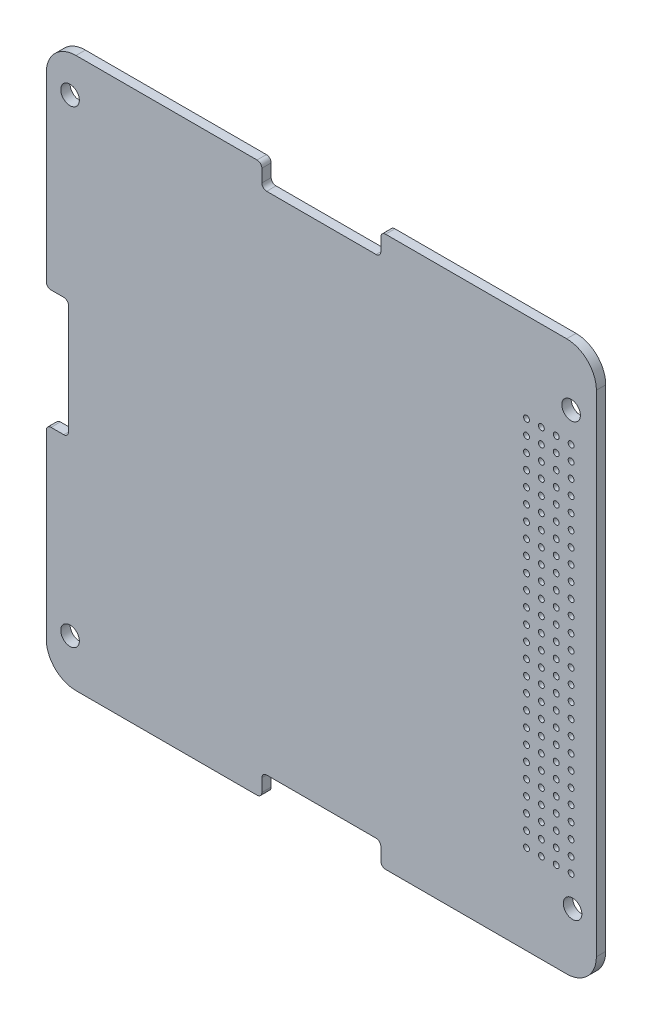
from build123d import *

# Parameters (mm, degrees)
SKETCH1_R           = 0.5
SKETCH1_R_2         = 1.5875
BOSS_EXTRUDE2_DEPTH = 1.6


with BuildPart() as part:
    # Sketch1 → Boss-Extrude2 (new body)
    with BuildSketch(Plane.XY):
        with BuildLine():
            Line((5.08, 0), (36.012420783, 0))
            ThreePointArc((36.012420783, 0), (36.590536591, 0.239463409), (36.83, 0.817579217))
            Line((36.83, 0.817579217), (36.83, 2.992420783))
            ThreePointArc((36.83, 2.992420783), (37.069463409, 3.570536591), (37.647579217, 3.81))
            Line((37.647579217, 3.81), (56.332420783, 3.81))
            ThreePointArc((56.332420783, 3.81), (56.910536591, 3.570536591), (57.15, 2.992420783))
            Line((57.15, 2.992420783), (57.15, 0.817579217))
            ThreePointArc((57.15, 0.817579217), (57.389463409, 0.239463409), (57.967579217, 0))
            Line((57.967579217, 0), (88.9, 0))
            ThreePointArc((88.9, 0), (92.492102448, 1.487897552), (93.98, 5.08))
            Line((93.98, 5.08), (93.98, 88.9))
            ThreePointArc((93.98, 88.9), (92.492102448, 92.492102448), (88.9, 93.98))
            Line((88.9, 93.98), (57.967579217, 93.98))
            ThreePointArc((57.967579217, 93.98), (57.389463409, 93.740536591), (57.15, 93.162420783))
            Line((57.15, 93.162420783), (57.15, 90.987579217))
            ThreePointArc((57.15, 90.987579217), (56.910536591, 90.409463409), (56.332420783, 90.17))
            Line((56.332420783, 90.17), (37.647579217, 90.17))
            ThreePointArc((37.647579217, 90.17), (37.069463409, 90.409463409), (36.83, 90.987579217))
            Line((36.83, 90.987579217), (36.83, 93.162420783))
            ThreePointArc((36.83, 93.162420783), (36.590536591, 93.740536591), (36.012420783, 93.98))
            Line((36.012420783, 93.98), (5.08, 93.98))
            ThreePointArc((5.08, 93.98), (1.487897552, 92.492102448), (0, 88.9))
            Line((0, 88.9), (0, 57.967579217))
            ThreePointArc((0, 57.967579217), (0.239463409, 57.389463409), (0.817579217, 57.15))
            Line((0.817579217, 57.15), (2.992420783, 57.15))
            ThreePointArc((2.992420783, 57.15), (3.570536591, 56.910536591), (3.81, 56.332420783))
            Line((3.81, 56.332420783), (3.81, 37.647579217))
            ThreePointArc((3.81, 37.647579217), (3.570536591, 37.069463409), (2.992420783, 36.83))
            Line((2.992420783, 36.83), (0.817579217, 36.83))
            ThreePointArc((0.817579217, 36.83), (0.239463409, 36.590536591), (0, 36.012420783))
            Line((0, 36.012420783), (0, 5.08))
            ThreePointArc((0, 5.08), (1.487897552, 1.487897552), (5.08, 0))
        make_face()
        with Locations((82.042, 78.74)):
            Circle(SKETCH1_R, mode=Mode.SUBTRACT)
        with Locations((84.582, 78.74)):
            Circle(SKETCH1_R, mode=Mode.SUBTRACT)
        with Locations((87.122, 78.74)):
            Circle(SKETCH1_R, mode=Mode.SUBTRACT)
        with Locations((89.662, 78.74)):
            Circle(SKETCH1_R, mode=Mode.SUBTRACT)
        with Locations((84.582, 76.2)):
            Circle(SKETCH1_R, mode=Mode.SUBTRACT)
        with Locations((87.122, 76.2)):
            Circle(SKETCH1_R, mode=Mode.SUBTRACT)
        with Locations((89.662, 76.2)):
            Circle(SKETCH1_R, mode=Mode.SUBTRACT)
        with Locations((84.582, 73.66)):
            Circle(SKETCH1_R, mode=Mode.SUBTRACT)
        with Locations((87.122, 73.66)):
            Circle(SKETCH1_R, mode=Mode.SUBTRACT)
        with Locations((89.662, 73.66)):
            Circle(SKETCH1_R, mode=Mode.SUBTRACT)
        with Locations((84.582, 71.12)):
            Circle(SKETCH1_R, mode=Mode.SUBTRACT)
        with Locations((87.122, 71.12)):
            Circle(SKETCH1_R, mode=Mode.SUBTRACT)
        with Locations((89.662, 71.12)):
            Circle(SKETCH1_R, mode=Mode.SUBTRACT)
        with Locations((84.582, 68.58)):
            Circle(SKETCH1_R, mode=Mode.SUBTRACT)
        with Locations((87.122, 68.58)):
            Circle(SKETCH1_R, mode=Mode.SUBTRACT)
        with Locations((89.662, 68.58)):
            Circle(SKETCH1_R, mode=Mode.SUBTRACT)
        with Locations((84.582, 66.04)):
            Circle(SKETCH1_R, mode=Mode.SUBTRACT)
        with Locations((87.122, 66.04)):
            Circle(SKETCH1_R, mode=Mode.SUBTRACT)
        with Locations((89.662, 66.04)):
            Circle(SKETCH1_R, mode=Mode.SUBTRACT)
        with Locations((84.582, 63.5)):
            Circle(SKETCH1_R, mode=Mode.SUBTRACT)
        with Locations((87.122, 63.5)):
            Circle(SKETCH1_R, mode=Mode.SUBTRACT)
        with Locations((89.662, 63.5)):
            Circle(SKETCH1_R, mode=Mode.SUBTRACT)
        with Locations((84.582, 60.96)):
            Circle(SKETCH1_R, mode=Mode.SUBTRACT)
        with Locations((87.122, 60.96)):
            Circle(SKETCH1_R, mode=Mode.SUBTRACT)
        with Locations((89.662, 60.96)):
            Circle(SKETCH1_R, mode=Mode.SUBTRACT)
        with Locations((84.582, 58.42)):
            Circle(SKETCH1_R, mode=Mode.SUBTRACT)
        with Locations((87.122, 58.42)):
            Circle(SKETCH1_R, mode=Mode.SUBTRACT)
        with Locations((89.662, 58.42)):
            Circle(SKETCH1_R, mode=Mode.SUBTRACT)
        with Locations((84.582, 55.88)):
            Circle(SKETCH1_R, mode=Mode.SUBTRACT)
        with Locations((87.122, 55.88)):
            Circle(SKETCH1_R, mode=Mode.SUBTRACT)
        with Locations((89.662, 55.88)):
            Circle(SKETCH1_R, mode=Mode.SUBTRACT)
        with Locations((84.582, 53.34)):
            Circle(SKETCH1_R, mode=Mode.SUBTRACT)
        with Locations((87.122, 53.34)):
            Circle(SKETCH1_R, mode=Mode.SUBTRACT)
        with Locations((89.662, 53.34)):
            Circle(SKETCH1_R, mode=Mode.SUBTRACT)
        with Locations((84.582, 50.8)):
            Circle(SKETCH1_R, mode=Mode.SUBTRACT)
        with Locations((87.122, 50.8)):
            Circle(SKETCH1_R, mode=Mode.SUBTRACT)
        with Locations((89.662, 50.8)):
            Circle(SKETCH1_R, mode=Mode.SUBTRACT)
        with Locations((84.582, 48.26)):
            Circle(SKETCH1_R, mode=Mode.SUBTRACT)
        with Locations((87.122, 48.26)):
            Circle(SKETCH1_R, mode=Mode.SUBTRACT)
        with Locations((89.662, 48.26)):
            Circle(SKETCH1_R, mode=Mode.SUBTRACT)
        with Locations((84.582, 45.72)):
            Circle(SKETCH1_R, mode=Mode.SUBTRACT)
        with Locations((87.122, 45.72)):
            Circle(SKETCH1_R, mode=Mode.SUBTRACT)
        with Locations((89.662, 45.72)):
            Circle(SKETCH1_R, mode=Mode.SUBTRACT)
        with Locations((84.582, 43.18)):
            Circle(SKETCH1_R, mode=Mode.SUBTRACT)
        with Locations((87.122, 43.18)):
            Circle(SKETCH1_R, mode=Mode.SUBTRACT)
        with Locations((89.662, 43.18)):
            Circle(SKETCH1_R, mode=Mode.SUBTRACT)
        with Locations((84.582, 40.64)):
            Circle(SKETCH1_R, mode=Mode.SUBTRACT)
        with Locations((87.122, 40.64)):
            Circle(SKETCH1_R, mode=Mode.SUBTRACT)
        with Locations((89.662, 40.64)):
            Circle(SKETCH1_R, mode=Mode.SUBTRACT)
        with Locations((84.582, 38.1)):
            Circle(SKETCH1_R, mode=Mode.SUBTRACT)
        with Locations((87.122, 38.1)):
            Circle(SKETCH1_R, mode=Mode.SUBTRACT)
        with Locations((89.662, 38.1)):
            Circle(SKETCH1_R, mode=Mode.SUBTRACT)
        with Locations((84.582, 35.56)):
            Circle(SKETCH1_R, mode=Mode.SUBTRACT)
        with Locations((87.122, 35.56)):
            Circle(SKETCH1_R, mode=Mode.SUBTRACT)
        with Locations((89.662, 35.56)):
            Circle(SKETCH1_R, mode=Mode.SUBTRACT)
        with Locations((84.582, 33.02)):
            Circle(SKETCH1_R, mode=Mode.SUBTRACT)
        with Locations((87.122, 33.02)):
            Circle(SKETCH1_R, mode=Mode.SUBTRACT)
        with Locations((89.662, 33.02)):
            Circle(SKETCH1_R, mode=Mode.SUBTRACT)
        with Locations((84.582, 30.48)):
            Circle(SKETCH1_R, mode=Mode.SUBTRACT)
        with Locations((87.122, 30.48)):
            Circle(SKETCH1_R, mode=Mode.SUBTRACT)
        with Locations((89.662, 30.48)):
            Circle(SKETCH1_R, mode=Mode.SUBTRACT)
        with Locations((84.582, 27.94)):
            Circle(SKETCH1_R, mode=Mode.SUBTRACT)
        with Locations((87.122, 27.94)):
            Circle(SKETCH1_R, mode=Mode.SUBTRACT)
        with Locations((89.662, 27.94)):
            Circle(SKETCH1_R, mode=Mode.SUBTRACT)
        with Locations((84.582, 25.4)):
            Circle(SKETCH1_R, mode=Mode.SUBTRACT)
        with Locations((87.122, 25.4)):
            Circle(SKETCH1_R, mode=Mode.SUBTRACT)
        with Locations((89.662, 25.4)):
            Circle(SKETCH1_R, mode=Mode.SUBTRACT)
        with Locations((84.582, 22.86)):
            Circle(SKETCH1_R, mode=Mode.SUBTRACT)
        with Locations((87.122, 22.86)):
            Circle(SKETCH1_R, mode=Mode.SUBTRACT)
        with Locations((89.662, 22.86)):
            Circle(SKETCH1_R, mode=Mode.SUBTRACT)
        with Locations((84.582, 20.32)):
            Circle(SKETCH1_R, mode=Mode.SUBTRACT)
        with Locations((87.122, 20.32)):
            Circle(SKETCH1_R, mode=Mode.SUBTRACT)
        with Locations((89.662, 20.32)):
            Circle(SKETCH1_R, mode=Mode.SUBTRACT)
        with Locations((84.582, 17.78)):
            Circle(SKETCH1_R, mode=Mode.SUBTRACT)
        with Locations((87.122, 17.78)):
            Circle(SKETCH1_R, mode=Mode.SUBTRACT)
        with Locations((89.662, 17.78)):
            Circle(SKETCH1_R, mode=Mode.SUBTRACT)
        with Locations((84.582, 15.24)):
            Circle(SKETCH1_R, mode=Mode.SUBTRACT)
        with Locations((87.122, 15.24)):
            Circle(SKETCH1_R, mode=Mode.SUBTRACT)
        with Locations((89.662, 15.24)):
            Circle(SKETCH1_R, mode=Mode.SUBTRACT)
        with Locations((82.042, 76.2)):
            Circle(SKETCH1_R, mode=Mode.SUBTRACT)
        with Locations((82.042, 73.66)):
            Circle(SKETCH1_R, mode=Mode.SUBTRACT)
        with Locations((82.042, 71.12)):
            Circle(SKETCH1_R, mode=Mode.SUBTRACT)
        with Locations((82.042, 68.58)):
            Circle(SKETCH1_R, mode=Mode.SUBTRACT)
        with Locations((82.042, 66.04)):
            Circle(SKETCH1_R, mode=Mode.SUBTRACT)
        with Locations((82.042, 63.5)):
            Circle(SKETCH1_R, mode=Mode.SUBTRACT)
        with Locations((82.042, 60.96)):
            Circle(SKETCH1_R, mode=Mode.SUBTRACT)
        with Locations((82.042, 58.42)):
            Circle(SKETCH1_R, mode=Mode.SUBTRACT)
        with Locations((82.042, 55.88)):
            Circle(SKETCH1_R, mode=Mode.SUBTRACT)
        with Locations((82.042, 53.34)):
            Circle(SKETCH1_R, mode=Mode.SUBTRACT)
        with Locations((82.042, 50.8)):
            Circle(SKETCH1_R, mode=Mode.SUBTRACT)
        with Locations((82.042, 48.26)):
            Circle(SKETCH1_R, mode=Mode.SUBTRACT)
        with Locations((82.042, 45.72)):
            Circle(SKETCH1_R, mode=Mode.SUBTRACT)
        with Locations((82.042, 43.18)):
            Circle(SKETCH1_R, mode=Mode.SUBTRACT)
        with Locations((82.042, 40.64)):
            Circle(SKETCH1_R, mode=Mode.SUBTRACT)
        with Locations((82.042, 38.1)):
            Circle(SKETCH1_R, mode=Mode.SUBTRACT)
        with Locations((82.042, 35.56)):
            Circle(SKETCH1_R, mode=Mode.SUBTRACT)
        with Locations((82.042, 33.02)):
            Circle(SKETCH1_R, mode=Mode.SUBTRACT)
        with Locations((82.042, 30.48)):
            Circle(SKETCH1_R, mode=Mode.SUBTRACT)
        with Locations((82.042, 27.94)):
            Circle(SKETCH1_R, mode=Mode.SUBTRACT)
        with Locations((82.042, 25.4)):
            Circle(SKETCH1_R, mode=Mode.SUBTRACT)
        with Locations((82.042, 22.86)):
            Circle(SKETCH1_R, mode=Mode.SUBTRACT)
        with Locations((82.042, 20.32)):
            Circle(SKETCH1_R, mode=Mode.SUBTRACT)
        with Locations((82.042, 17.78)):
            Circle(SKETCH1_R, mode=Mode.SUBTRACT)
        with Locations((82.042, 15.24)):
            Circle(SKETCH1_R, mode=Mode.SUBTRACT)
        with Locations((89.916, 10.16)):
            Circle(SKETCH1_R_2, mode=Mode.SUBTRACT)
        with Locations((89.662, 83.82)):
            Circle(SKETCH1_R_2, mode=Mode.SUBTRACT)
        with Locations((4.064, 7.62)):
            Circle(SKETCH1_R_2, mode=Mode.SUBTRACT)
        with Locations((4.064, 87.63)):
            Circle(SKETCH1_R_2, mode=Mode.SUBTRACT)
    extrude(amount=BOSS_EXTRUDE2_DEPTH)


solid = part.part
